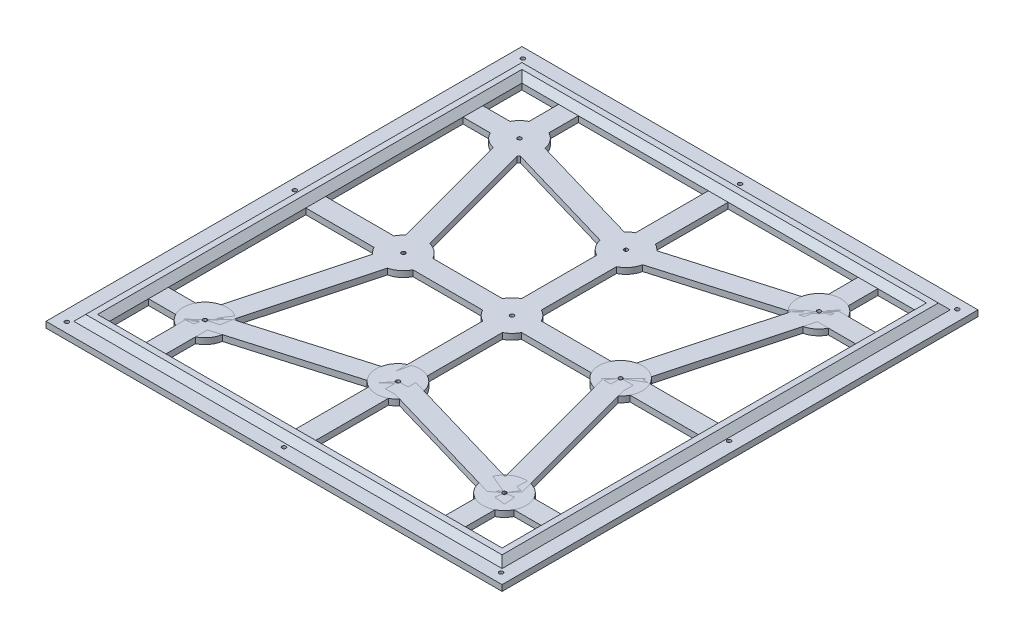
from build123d import *

# Parameters (mm, degrees)
SKETCH1_W           = 230
SKETCH1_H           = 240
BOSS_EXTRUDE1_DEPTH = 3
CUT_EXTRUDE1_REACH  = 168.235
SKETCH2_R           = 1
SKETCH4_W           = 210
SKETCH4_H           = 220
SKETCH4_W_2         = 204
SKETCH4_H_2         = 214
BOSS_EXTRUDE2_DEPTH = 3
CHAMFER1_SIZE       = 3
CUT_EXTRUDE2_REACH  = 168.235
SKETCH5_W           = 198
SKETCH5_H           = 208
SKETCH5_R           = 11
SKETCH6_W           = 43.25
SKETCH6_H           = 10
SKETCH6_W_2         = 10
SKETCH6_H_2         = 55.5
SKETCH6_W_3         = 22.491368523
SKETCH6_H_3         = 23.698697536
SKETCH6_W_4         = 52.75
SKETCH6_H_4         = 45.5
EXTRUDE_THIN2_DEPTH = 3


with BuildPart() as part:
    # Sketch1 → Boss-Extrude1 (new body)
    with BuildSketch(Plane(origin=(0, 0, 0), x_dir=(1, 0, 0), z_dir=(0, 1, 0))):
        Rectangle(SKETCH1_W, SKETCH1_H)
    extrude(amount=BOSS_EXTRUDE1_DEPTH)

    # Sketch2 → Cut-Extrude1 (cut, up to next)
    with BuildSketch(Plane(origin=(0, 3, 0), x_dir=(1, 0, 0), z_dir=(0, 1, 0)), mode=Mode.PRIVATE) as cut_extrude1_sk1:
        with Locations(Location((-109.5, -115, 0), (0, 0, 270))):
            Circle(SKETCH2_R)
    cut_extrude1_tool1 = extrude(cut_extrude1_sk1.sketch, amount=-CUT_EXTRUDE1_REACH, mode=Mode.PRIVATE) & part.part
    # Sketch2 → Cut-Extrude1 (cut, up to next)
    with BuildSketch(Plane(origin=(0, 3, 0), x_dir=(1, 0, 0), z_dir=(0, 1, 0)), mode=Mode.PRIVATE) as cut_extrude1_sk2:
        with Locations(Location((109.5, -115, 0), (0, 0, 270))):
            Circle(SKETCH2_R)
    cut_extrude1_tool2 = extrude(cut_extrude1_sk2.sketch, amount=-CUT_EXTRUDE1_REACH, mode=Mode.PRIVATE) & part.part
    # Sketch2 → Cut-Extrude1 (cut, up to next)
    with BuildSketch(Plane(origin=(0, 3, 0), x_dir=(1, 0, 0), z_dir=(0, 1, 0)), mode=Mode.PRIVATE) as cut_extrude1_sk3:
        with Locations(Location((0, -115, 0), (0, 0, 270))):
            Circle(SKETCH2_R)
    cut_extrude1_tool3 = extrude(cut_extrude1_sk3.sketch, amount=-CUT_EXTRUDE1_REACH, mode=Mode.PRIVATE) & part.part
    # Sketch2 → Cut-Extrude1 (cut, up to next)
    with BuildSketch(Plane(origin=(0, 3, 0), x_dir=(1, 0, 0), z_dir=(0, 1, 0)), mode=Mode.PRIVATE) as cut_extrude1_sk4:
        with Locations(Location((-75.508631477, -79.301302464, 0), (0, 0, 270))):
            Circle(SKETCH2_R)
    cut_extrude1_tool4 = extrude(cut_extrude1_sk4.sketch, amount=-CUT_EXTRUDE1_REACH, mode=Mode.PRIVATE) & part.part
    # Sketch2 → Cut-Extrude1 (cut, up to next)
    with BuildSketch(Plane(origin=(0, 3, 0), x_dir=(1, 0, 0), z_dir=(0, 1, 0)), mode=Mode.PRIVATE) as cut_extrude1_sk5:
        with Locations(Location((75.508631477, -79.301302464, 0), (0, 0, 270))):
            Circle(SKETCH2_R)
    cut_extrude1_tool5 = extrude(cut_extrude1_sk5.sketch, amount=-CUT_EXTRUDE1_REACH, mode=Mode.PRIVATE) & part.part
    # Sketch2 → Cut-Extrude1 (cut, up to next)
    with BuildSketch(Plane(origin=(0, 3, 0), x_dir=(1, 0, 0), z_dir=(0, 1, 0)), mode=Mode.PRIVATE) as cut_extrude1_sk6:
        with Locations(Location((0, 0, 0), (0, 0, 270))):
            Circle(SKETCH2_R)
    cut_extrude1_tool6 = extrude(cut_extrude1_sk6.sketch, amount=-CUT_EXTRUDE1_REACH, mode=Mode.PRIVATE) & part.part
    # Sketch2 → Cut-Extrude1 (cut, up to next)
    with BuildSketch(Plane(origin=(0, 3, 0), x_dir=(1, 0, 0), z_dir=(0, 1, 0)), mode=Mode.PRIVATE) as cut_extrude1_sk7:
        with Locations(Location((-109.5, 0, 0), (0, 0, 270))):
            Circle(SKETCH2_R)
    cut_extrude1_tool7 = extrude(cut_extrude1_sk7.sketch, amount=-CUT_EXTRUDE1_REACH, mode=Mode.PRIVATE) & part.part
    # Sketch2 → Cut-Extrude1 (cut, up to next)
    with BuildSketch(Plane(origin=(0, 3, 0), x_dir=(1, 0, 0), z_dir=(0, 1, 0)), mode=Mode.PRIVATE) as cut_extrude1_sk8:
        with Locations(Location((-109.5, 115, 0), (0, 0, 270))):
            Circle(SKETCH2_R)
    cut_extrude1_tool8 = extrude(cut_extrude1_sk8.sketch, amount=-CUT_EXTRUDE1_REACH, mode=Mode.PRIVATE) & part.part
    # Sketch2 → Cut-Extrude1 (cut, up to next)
    with BuildSketch(Plane(origin=(0, 3, 0), x_dir=(1, 0, 0), z_dir=(0, 1, 0)), mode=Mode.PRIVATE) as cut_extrude1_sk9:
        with Locations(Location((-75.508631477, 79.301302464, 0), (0, 0, 270))):
            Circle(SKETCH2_R)
    cut_extrude1_tool9 = extrude(cut_extrude1_sk9.sketch, amount=-CUT_EXTRUDE1_REACH, mode=Mode.PRIVATE) & part.part
    # Sketch2 → Cut-Extrude1 (cut, up to next)
    with BuildSketch(Plane(origin=(0, 3, 0), x_dir=(1, 0, 0), z_dir=(0, 1, 0)), mode=Mode.PRIVATE) as cut_extrude1_sk10:
        with Locations(Location((75.508631477, 79.301302464, 0), (0, 0, 270))):
            Circle(SKETCH2_R)
    cut_extrude1_tool10 = extrude(cut_extrude1_sk10.sketch, amount=-CUT_EXTRUDE1_REACH, mode=Mode.PRIVATE) & part.part
    # Sketch2 → Cut-Extrude1 (cut, up to next)
    with BuildSketch(Plane(origin=(0, 3, 0), x_dir=(1, 0, 0), z_dir=(0, 1, 0)), mode=Mode.PRIVATE) as cut_extrude1_sk11:
        with Locations(Location((0, 115, 0), (0, 0, 270))):
            Circle(SKETCH2_R)
    cut_extrude1_tool11 = extrude(cut_extrude1_sk11.sketch, amount=-CUT_EXTRUDE1_REACH, mode=Mode.PRIVATE) & part.part
    # Sketch2 → Cut-Extrude1 (cut, up to next)
    with BuildSketch(Plane(origin=(0, 3, 0), x_dir=(1, 0, 0), z_dir=(0, 1, 0)), mode=Mode.PRIVATE) as cut_extrude1_sk12:
        with Locations(Location((109.5, 115, 0), (0, 0, 270))):
            Circle(SKETCH2_R)
    cut_extrude1_tool12 = extrude(cut_extrude1_sk12.sketch, amount=-CUT_EXTRUDE1_REACH, mode=Mode.PRIVATE) & part.part
    # Sketch2 → Cut-Extrude1 (cut, up to next)
    with BuildSketch(Plane(origin=(0, 3, 0), x_dir=(1, 0, 0), z_dir=(0, 1, 0)), mode=Mode.PRIVATE) as cut_extrude1_sk13:
        with Locations(Location((109.5, 0, 0), (0, 0, 270))):
            Circle(SKETCH2_R)
    cut_extrude1_tool13 = extrude(cut_extrude1_sk13.sketch, amount=-CUT_EXTRUDE1_REACH, mode=Mode.PRIVATE) & part.part
    # Sketch2 → Cut-Extrude1 (cut, up to next)
    with BuildSketch(Plane(origin=(0, 3, 0), x_dir=(1, 0, 0), z_dir=(0, 1, 0)), mode=Mode.PRIVATE) as cut_extrude1_sk14:
        with Locations(Location((0, 57.5, 0), (0, 0, 270))):
            Circle(SKETCH2_R)
    cut_extrude1_tool14 = extrude(cut_extrude1_sk14.sketch, amount=-CUT_EXTRUDE1_REACH, mode=Mode.PRIVATE) & part.part
    # Sketch2 → Cut-Extrude1 (cut, up to next)
    with BuildSketch(Plane(origin=(0, 3, 0), x_dir=(1, 0, 0), z_dir=(0, 1, 0)), mode=Mode.PRIVATE) as cut_extrude1_sk15:
        with Locations(Location((0, -57.5, 0), (0, 0, 270))):
            Circle(SKETCH2_R)
    cut_extrude1_tool15 = extrude(cut_extrude1_sk15.sketch, amount=-CUT_EXTRUDE1_REACH, mode=Mode.PRIVATE) & part.part
    # Sketch2 → Cut-Extrude1 (cut, up to next)
    with BuildSketch(Plane(origin=(0, 3, 0), x_dir=(1, 0, 0), z_dir=(0, 1, 0)), mode=Mode.PRIVATE) as cut_extrude1_sk16:
        with Locations(Location((-54.75, 0, 0), (0, 0, 270))):
            Circle(SKETCH2_R)
    cut_extrude1_tool16 = extrude(cut_extrude1_sk16.sketch, amount=-CUT_EXTRUDE1_REACH, mode=Mode.PRIVATE) & part.part
    # Sketch2 → Cut-Extrude1 (cut, up to next)
    with BuildSketch(Plane(origin=(0, 3, 0), x_dir=(1, 0, 0), z_dir=(0, 1, 0)), mode=Mode.PRIVATE) as cut_extrude1_sk17:
        with Locations(Location((54.75, 0, 0), (0, 0, 270))):
            Circle(SKETCH2_R)
    cut_extrude1_tool17 = extrude(cut_extrude1_sk17.sketch, amount=-CUT_EXTRUDE1_REACH, mode=Mode.PRIVATE) & part.part
    add(cut_extrude1_tool1.solids().sort_by_distance((-109.5, 3, 115))[0], mode=Mode.SUBTRACT)
    add(cut_extrude1_tool2.solids().sort_by_distance((109.5, 3, 115))[0], mode=Mode.SUBTRACT)
    add(cut_extrude1_tool3.solids().sort_by_distance((0, 3, 115))[0], mode=Mode.SUBTRACT)
    add(cut_extrude1_tool4.solids().sort_by_distance((-75.508631, 3, 79.301302))[0], mode=Mode.SUBTRACT)
    add(cut_extrude1_tool5.solids().sort_by_distance((75.508631, 3, 79.301302))[0], mode=Mode.SUBTRACT)
    add(cut_extrude1_tool6.solids().sort_by_distance((0, 3, 0))[0], mode=Mode.SUBTRACT)
    add(cut_extrude1_tool7.solids().sort_by_distance((-109.5, 3, 0))[0], mode=Mode.SUBTRACT)
    add(cut_extrude1_tool8.solids().sort_by_distance((-109.5, 3, -115))[0], mode=Mode.SUBTRACT)
    add(cut_extrude1_tool9.solids().sort_by_distance((-75.508631, 3, -79.301302))[0], mode=Mode.SUBTRACT)
    add(cut_extrude1_tool10.solids().sort_by_distance((75.508631, 3, -79.301302))[0], mode=Mode.SUBTRACT)
    add(cut_extrude1_tool11.solids().sort_by_distance((0, 3, -115))[0], mode=Mode.SUBTRACT)
    add(cut_extrude1_tool12.solids().sort_by_distance((109.5, 3, -115))[0], mode=Mode.SUBTRACT)
    add(cut_extrude1_tool13.solids().sort_by_distance((109.5, 3, 0))[0], mode=Mode.SUBTRACT)
    add(cut_extrude1_tool14.solids().sort_by_distance((0, 3, -57.5))[0], mode=Mode.SUBTRACT)
    add(cut_extrude1_tool15.solids().sort_by_distance((0, 3, 57.5))[0], mode=Mode.SUBTRACT)
    add(cut_extrude1_tool16.solids().sort_by_distance((-54.75, 3, 0))[0], mode=Mode.SUBTRACT)
    add(cut_extrude1_tool17.solids().sort_by_distance((54.75, 3, 0))[0], mode=Mode.SUBTRACT)

    # Sketch4 → Boss-Extrude2 (add)
    with BuildSketch(Plane(origin=(0, 3, 0), x_dir=(1, 0, 0), z_dir=(0, 1, 0))):
        Rectangle(SKETCH4_W, SKETCH4_H)
        Rectangle(SKETCH4_W_2, SKETCH4_H_2, mode=Mode.SUBTRACT)
    extrude(amount=BOSS_EXTRUDE2_DEPTH)

    # Chamfer1
    chamfer1_edges = [part.edges().sort_by_distance(p)[0] for p in [
        (0, 3, -110),
        (105, 3, 0),
        (0, 3, 110),
        (-105, 3, 0),
        (0, 3, -107),
        (102, 3, 0),
        (0, 3, 107),
        (-102, 3, 0),
    ]]
    chamfer(chamfer1_edges, length=CHAMFER1_SIZE - 0.0001)  # a hair under: the kernel refuses the full size

    # Sketch5 → Cut-Extrude2 (cut, up to next)
    with BuildSketch(Plane(origin=(0, 3, 0), x_dir=(1, 0, 0), z_dir=(0, 1, 0)), mode=Mode.PRIVATE) as cut_extrude2_sk1:
        Rectangle(SKETCH5_W, SKETCH5_H)
        with Locations(Location((0, 0, 0), (0, 0, 270))):
            Circle(SKETCH5_R, mode=Mode.SUBTRACT)
        with Locations(Location((75.508631477, 79.301302464, 0), (0, 0, 270))):
            Circle(SKETCH5_R, mode=Mode.SUBTRACT)
        with Locations(Location((54.75, 0, 0), (0, 0, 270))):
            Circle(SKETCH5_R, mode=Mode.SUBTRACT)
        with Locations(Location((-54.75, 0, 0), (0, 0, 270))):
            Circle(SKETCH5_R, mode=Mode.SUBTRACT)
        with Locations(Location((0, -57.5, 0), (0, 0, 270))):
            Circle(SKETCH5_R, mode=Mode.SUBTRACT)
        with Locations(Location((0, 57.5, 0), (0, 0, 270))):
            Circle(SKETCH5_R, mode=Mode.SUBTRACT)
        with Locations(Location((-75.508631477, 79.301302464, 0), (0, 0, 270))):
            Circle(SKETCH5_R, mode=Mode.SUBTRACT)
        with Locations(Location((75.508631477, -79.301302464, 0), (0, 0, 270))):
            Circle(SKETCH5_R, mode=Mode.SUBTRACT)
        with Locations(Location((-75.508631477, -79.301302464, 0), (0, 0, 270))):
            Circle(SKETCH5_R, mode=Mode.SUBTRACT)
    cut_extrude2_tool1 = extrude(cut_extrude2_sk1.sketch, amount=-CUT_EXTRUDE2_REACH, mode=Mode.PRIVATE) & part.part
    add(cut_extrude2_tool1.solids().sort_by_distance((96.128276, 3, 0))[0], mode=Mode.SUBTRACT)


with BuildPart() as cut_extrude2_piece_1:
    # of the separate pieces the step leaves, piece 1, a body of its own (cut_extrude2_pieces)
    add(part.part.solids().sort_by_distance((107.9999, 3, -112.9999))[0])


with BuildPart() as cut_extrude2_piece_2:
    # of the separate pieces the step leaves, piece 2, a body of its own (cut_extrude2_pieces)
    add(part.part.solids().sort_by_distance((0, 0, 68.5))[0])


with BuildPart() as cut_extrude2_piece_3:
    # of the separate pieces the step leaves, piece 3, a body of its own (cut_extrude2_pieces)
    add(part.part.solids().sort_by_distance((0, 0, -46.5))[0])


with BuildPart() as cut_extrude2_piece_4:
    # of the separate pieces the step leaves, piece 4, a body of its own (cut_extrude2_pieces)
    add(part.part.solids().sort_by_distance((0, 0, 11))[0])


with BuildPart() as cut_extrude2_piece_5:
    # of the separate pieces the step leaves, piece 5, a body of its own (cut_extrude2_pieces)
    add(part.part.solids().sort_by_distance((75.508631477, 0, 90.301302464))[0])


with BuildPart() as cut_extrude2_piece_6:
    # of the separate pieces the step leaves, piece 6, a body of its own (cut_extrude2_pieces)
    add(part.part.solids().sort_by_distance((-75.508631477, 0, 90.301302464))[0])


with BuildPart() as cut_extrude2_piece_7:
    # of the separate pieces the step leaves, piece 7, a body of its own (cut_extrude2_pieces)
    add(part.part.solids().sort_by_distance((75.508631477, 0, -68.301302464))[0])


with BuildPart() as cut_extrude2_piece_8:
    # of the separate pieces the step leaves, piece 8, a body of its own (cut_extrude2_pieces)
    add(part.part.solids().sort_by_distance((-75.508631477, 0, -68.301302464))[0])


with BuildPart() as cut_extrude2_piece_9:
    # of the separate pieces the step leaves, piece 9, a body of its own (cut_extrude2_pieces)
    add(part.part.solids().sort_by_distance((54.75, 0, 11))[0])


with BuildPart() as cut_extrude2_piece_10:
    # of the separate pieces the step leaves, piece 10, a body of its own (cut_extrude2_pieces)
    add(part.part.solids().sort_by_distance((-54.75, 0, 11))[0])


    add(cut_extrude2_piece_1.part)  # Extrude-Thin2 merges Cut-Extrude2 piece 1

    add(cut_extrude2_piece_8.part)  # Extrude-Thin2 merges Cut-Extrude2 piece 8

    add(cut_extrude2_piece_3.part)  # Extrude-Thin2 merges Cut-Extrude2 piece 3

    add(cut_extrude2_piece_4.part)  # Extrude-Thin2 merges Cut-Extrude2 piece 4
    # Sketch6 → Extrude-Thin2 (add)
    with BuildSketch(Plane(origin=(0, 3, 0), x_dir=(1, 0, 0), z_dir=(0, 1, 0))):
        with Locations((-77.375, 0)):
            Rectangle(SKETCH6_W, SKETCH6_H)
        Polygon((-75.953004658, 74.22168314), (-2.404131775, 52.701207031), (0.404131775, 62.298792969), (-73.144741108, 83.819269078), align=None)
        Polygon((-80.337544449, 77.004537447), (-59.578912972, -0.296765017), (-49.921087028, 2.296765017), (-70.679718505, 79.598067481), align=None)
        with Locations((0, 28.75)):
            Rectangle(SKETCH6_W_2, SKETCH6_H_2)
        with Locations((-87.754315738, 79.301302464)):
            Rectangle(SKETCH6_W_3, SKETCH6_H)
        with Locations((-75.508631477, 92.150651232)):
            Rectangle(SKETCH6_W_2, SKETCH6_H_3)
        with Locations((27.375, 0)):
            Rectangle(SKETCH6_W_4, SKETCH6_H)
        with Locations((75.508631477, 92.150651232)):
            Rectangle(SKETCH6_W_2, SKETCH6_H_3)
        with Locations((87.754315738, 79.301302464)):
            Rectangle(SKETCH6_W_3, SKETCH6_H)
        Polygon((70.679718505, 79.598067481), (49.921087028, 2.296765017), (59.578912972, -0.296765017), (80.337544449, 77.004537447), align=None)
        Polygon((73.144741108, 83.819269078), (-0.404131775, 62.298792969), (2.404131775, 52.701207031), (75.953004658, 74.22168314), align=None)
        with Locations((0, 81.25)):
            Rectangle(SKETCH6_W_2, SKETCH6_H_4)
        with Locations((77.375, 0)):
            Rectangle(SKETCH6_W, SKETCH6_H)
        with Locations((-27.375, 0)):
            Rectangle(SKETCH6_W_4, SKETCH6_H)
        with Locations((0, -81.25)):
            Rectangle(SKETCH6_W_2, SKETCH6_H_4)
        Polygon((75.953004658, -74.22168314), (2.404131775, -52.701207031), (-0.404131775, -62.298792969), (73.144741108, -83.819269078), align=None)
        Polygon((80.337544449, -77.004537447), (59.578912972, 0.296765017), (49.921087028, -2.296765017), (70.679718505, -79.598067481), align=None)
        with Locations((87.754315738, -79.301302464)):
            Rectangle(SKETCH6_W_3, SKETCH6_H)
        with Locations((75.508631477, -92.150651232)):
            Rectangle(SKETCH6_W_2, SKETCH6_H_3)
        with Locations((-75.508631477, -92.150651232)):
            Rectangle(SKETCH6_W_2, SKETCH6_H_3)
        with Locations((-87.754315738, -79.301302464)):
            Rectangle(SKETCH6_W_3, SKETCH6_H)
        with Locations((0, -28.75)):
            Rectangle(SKETCH6_W_2, SKETCH6_H_2)
        Polygon((-70.679718505, -79.598067481), (-49.921087028, -2.296765017), (-59.578912972, 0.296765017), (-80.337544449, -77.004537447), align=None)
        Polygon((-73.144741108, -83.819269078), (0.404131775, -62.298792969), (-2.404131775, -52.701207031), (-75.953004658, -74.22168314), align=None)
    extrude(amount=-EXTRUDE_THIN2_DEPTH)


solid = Compound([cut_extrude2_piece_2.part, cut_extrude2_piece_5.part, cut_extrude2_piece_6.part, cut_extrude2_piece_7.part, cut_extrude2_piece_9.part, cut_extrude2_piece_10.part])
